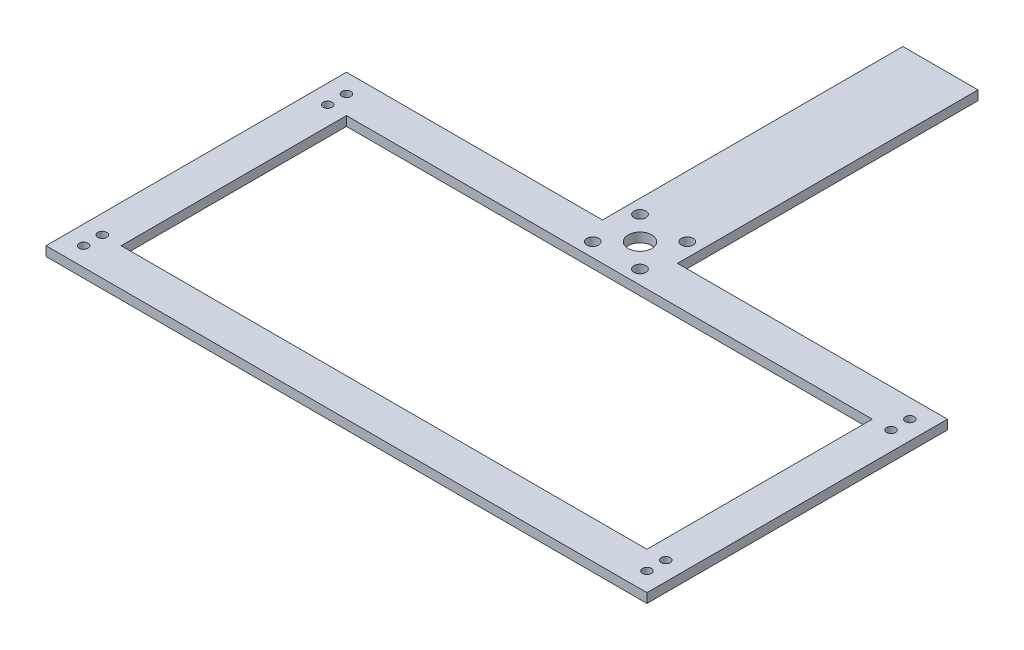
from build123d import *

# Parameters (mm, degrees)
SKETCH1_W           = 177.8
SKETCH1_H           = 76.2
SKETCH1_R           = 1.5
BOSS_EXTRUDE1_DEPTH = 3.175
SKETCH2_R           = 4
SKETCH2_R_2         = 2
CUT_EXTRUDE1_DEPTH  = 3.175


with BuildPart() as part:
    # Sketch1 → Boss-Extrude1 (new body)
    with BuildSketch(Plane(origin=(0, 0, 0), x_dir=(1, 0, 0), z_dir=(0, 1, 0))):
        Polygon((86.546196593, 101.6), (6.35, 101.6), (0, 101.6), (0, 0), (203.2, 0), (203.2, 101.6), (111.946196593, 101.6), (111.946196593, 203.2), (86.546196593, 203.2), align=None)
        with Locations((101.6, 50.8)):
            Rectangle(SKETCH1_W, SKETCH1_H, mode=Mode.SUBTRACT)
        with Locations((6.35, 88.9)):
            Circle(SKETCH1_R, mode=Mode.SUBTRACT)
        with BuildLine():
            ThreePointArc((6.35, 93.75), (4.85, 95.25), (6.35, 96.75))
            ThreePointArc((6.35, 96.75), (7.85, 95.25), (6.35, 93.75))
        make_face(mode=Mode.SUBTRACT)
        with Locations((196.85, 6.35)):
            Circle(SKETCH1_R, mode=Mode.SUBTRACT)
        with Locations((196.85, 12.7)):
            Circle(SKETCH1_R, mode=Mode.SUBTRACT)
        with Locations((196.85, 88.9)):
            Circle(SKETCH1_R, mode=Mode.SUBTRACT)
        with Locations((196.85, 95.25)):
            Circle(SKETCH1_R, mode=Mode.SUBTRACT)
        with Locations((6.35, 6.35)):
            Circle(SKETCH1_R, mode=Mode.SUBTRACT)
        with Locations((6.35, 12.7)):
            Circle(SKETCH1_R, mode=Mode.SUBTRACT)
    extrude(amount=BOSS_EXTRUDE1_DEPTH)

    # Sketch2 → Cut-Extrude1 (cut)
    with BuildSketch(Plane(origin=(0, 3.175, 0), x_dir=(1, 0, 0), z_dir=(0, 1, 0))):
        with Locations((99.246196593, 101.6)):
            Circle(SKETCH2_R)
        with Locations((107.246196593, 109.6)):
            Circle(SKETCH2_R_2)
        with Locations((107.246196593, 93.6)):
            Circle(SKETCH2_R_2)
        with Locations((91.246196593, 93.6)):
            Circle(SKETCH2_R_2)
        with Locations((91.246196593, 109.6)):
            Circle(SKETCH2_R_2)
    extrude(amount=-CUT_EXTRUDE1_DEPTH, mode=Mode.SUBTRACT)


solid = part.part
